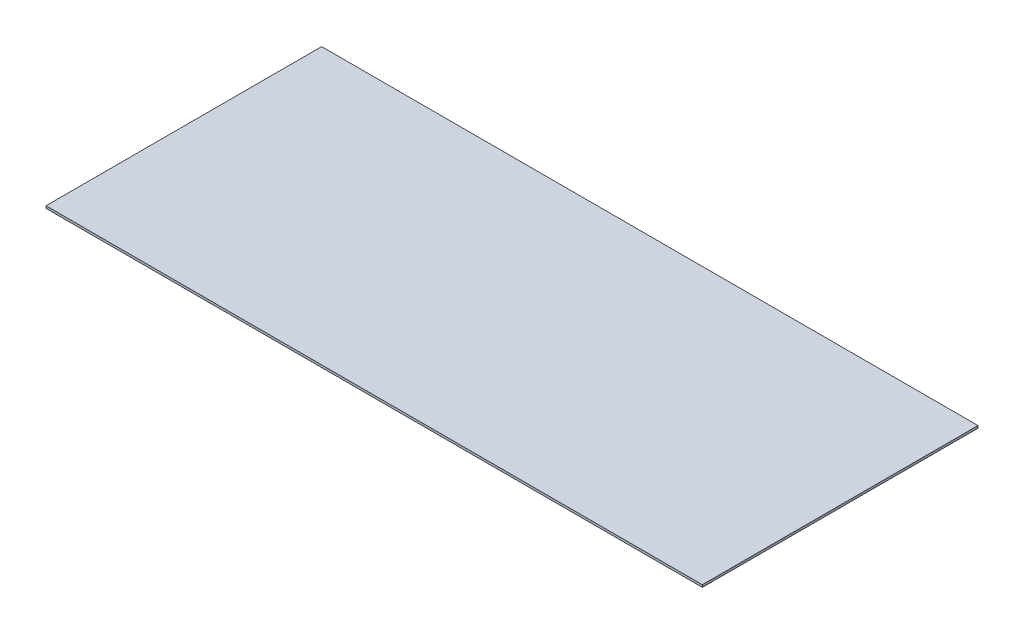
from build123d import *

# Parameters (mm, degrees)
SKETCH1_W           = 892.175
SKETCH1_H           = 374.65
BOSS_EXTRUDE1_DEPTH = 3.175


with BuildPart() as part:
    # Sketch1 → Boss-Extrude1 (new body)
    with BuildSketch(Plane(origin=(0, 0, 0), x_dir=(1, 0, 0), z_dir=(0, 1, 0))):
        Rectangle(SKETCH1_W, SKETCH1_H)
    extrude(amount=BOSS_EXTRUDE1_DEPTH)


solid = part.part
